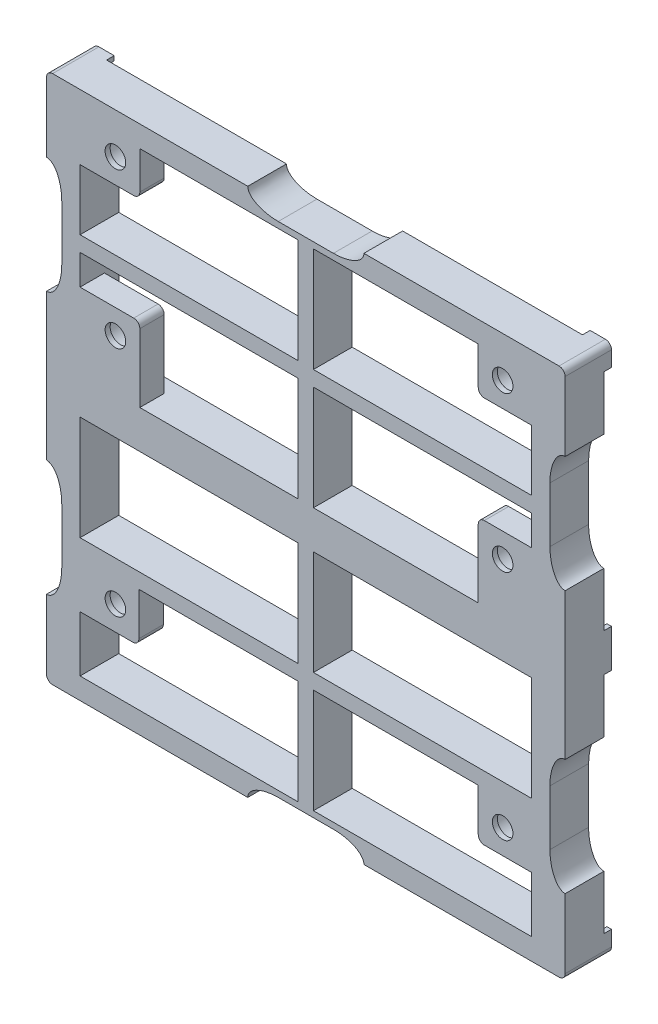
from build123d import *

# Parameters (mm, degrees)
SKETCH1_W                                        = 170.1
SKETCH1_H                                        = 87.55
SKETCH1_W_2                                      = 148.1
SKETCH1_H_2                                      = 73.55
SKETCH1_W_3                                      = 71.55
SKETCH1_H_3                                      = 5
SKETCH1_W_4                                      = 5
SKETCH1_H_4                                      = 34.275
BOSS_EXTRUDE1_DEPTH                              = 12.7
SKETCH2_W                                        = 2.5
SKETCH2_H                                        = 4.7
SKETCH2_W_2                                      = 4.501529918
SKETCH2_H_2                                      = 2.5
SKETCH2_W_3                                      = 4.5
BOSS_EXTRUDE2_DEPTH                              = 2.5
SKETCH12_W                                       = 167.1
SKETCH12_H                                       = 84.55
CUT_EXTRUDE2_DEPTH                               = 223.96352429
F_1_8_0_1250_DOWEL_HOLE2_AT_2_COUNT              = 2
F_1_8_0_1250_DOWEL_HOLE2_AT_2_PITCH              = 72.55
F_1_8_0_1250_DOWEL_HOLE2_AT_3_COUNT              = 2
F_1_8_0_1250_DOWEL_HOLE2_AT_3_PITCH              = 155.1
BOSS_EXTRUDE4_DEPTH                              = 8
CBORE_FOR_1_4_SOCKET_HEAD_CAP_SCREW1_D           = 6.7564
CBORE_FOR_1_4_SOCKET_HEAD_CAP_SCREW1_CBORE_D     = 11.1125
CBORE_FOR_1_4_SOCKET_HEAD_CAP_SCREW1_CBORE_DEPTH = 6.35
SKETCH13_W                                       = 10
SKETCH13_H                                       = 38.1
SKETCH13_W_2                                     = 38.1
SKETCH13_H_2                                     = 10
CUT_EXTRUDE3_DEPTH                               = 15
FILLET4_SIZE                                     = 10
FILLET4_SIZE_2                                   = 5
MIRROR1_OUTLINE_W                                = 71.55
MIRROR1_OUTLINE_H                                = 34.275
MIRROR1_DEPTH                                    = 12.7
MIRROR1_START                                    = -2.5
MIRROR1_2_OUTLINE_W                              = 1.5
MIRROR1_2_OUTLINE_H                              = 5.5
MIRROR1_2_DEPTH                                  = 2.5
FILLET2_R                                        = 2
BOSS_EXTRUDE5_DEPTH                              = 8
CBORE_FOR_1_4_SOCKET_HEAD_CAP_SCREW2_D           = 6.7564
CBORE_FOR_1_4_SOCKET_HEAD_CAP_SCREW2_CBORE_D     = 11.1125
CBORE_FOR_1_4_SOCKET_HEAD_CAP_SCREW2_CBORE_DEPTH = 6.35
LPATTERN3_COUNT                                  = 2
LPATTERN3_PITCH                                  = 86.05


# Read off the part's stored shape, not the designer's step: Mirror1
with BuildPart() as part:
    # Sketch1 → Boss-Extrude1 (new body)
    # profile 1 of 6: a face of its own
    with BuildSketch(Plane.XY):
        with Locations((-57.284342841, -127.375162174)):
            Rectangle(SKETCH1_W, SKETCH1_H)
        with Locations((-57.284342841, -127.375162174)):
            Rectangle(SKETCH1_W_2, SKETCH1_H_2, mode=Mode.SUBTRACT)
    # profile 2 of 6: a face of its own
    with BuildSketch(Plane.XY):
        with Locations((-95.559342841, -127.375162174)):
            Rectangle(SKETCH1_W_3, SKETCH1_H_3)
    # profile 3 of 6: a face of its own
    with BuildSketch(Plane.XY):
        with Locations((-57.284342841, -107.737662174)):
            Rectangle(SKETCH1_W_4, SKETCH1_H_4)
    # profile 4 of 6: a face of its own
    with BuildSketch(Plane.XY):
        with Locations((-19.009342841, -127.375162174)):
            Rectangle(SKETCH1_W_3, SKETCH1_H_3)
    # profile 5 of 6: a face of its own
    with BuildSketch(Plane.XY):
        with Locations((-57.284342841, -147.012662174)):
            Rectangle(SKETCH1_W_4, SKETCH1_H_4)
    # profile 6 of 6: a face of its own
    with BuildSketch(Plane.XY):
        with Locations((-57.284342841, -127.375162174)):
            Rectangle(SKETCH1_W_4, SKETCH1_H_3)
    extrude(amount=BOSS_EXTRUDE1_DEPTH)

    # Sketch2 → Boss-Extrude2 (add)
    with BuildSketch(Plane(origin=(0, 0, 0), x_dir=(-1, 0, 0), z_dir=(0, 0, -1))):
        Polygon((135.334342841, -168.850162174), (135.334342841, -171.150162174), (142.334342841, -171.150162174), (142.334342841, -168.850162174), (139.834342841, -168.850162174), align=None)
        with Locations((141.084342841, -166.500162174)):
            Rectangle(SKETCH2_W, SKETCH2_H)
        Polygon((139.834342841, -90.600162174), (142.334342841, -90.600162174), (142.334342841, -83.600162174), (139.834342841, -83.600162174), (139.834342841, -86.100162174), align=None)
        with Locations((137.583577882, -84.850162174)):
            Rectangle(SKETCH2_W_2, SKETCH2_H_2)
        Polygon((-27.765657159, -83.600162174), (-27.765657159, -90.600162174), (-25.265657159, -90.600162174), (-25.265657159, -86.100162174), (-25.265657159, -83.600162174), align=None)
        with Locations((-23.015657159, -84.850162174)):
            Rectangle(SKETCH2_W_3, SKETCH2_H_2)
        Polygon((-27.765657159, -164.150162174), (-27.765657159, -171.150162174), (-25.265657159, -171.150162174), (-25.265657159, -168.650162174), (-25.265657159, -164.150162174), align=None)
        with Locations((-23.015657159, -169.900162174)):
            Rectangle(SKETCH2_W_3, SKETCH2_H_2)
    extrude(amount=BOSS_EXTRUDE2_DEPTH)

    # Sketch12 → Cut-Extrude2 (cut, through all)
    with BuildSketch(Plane(origin=(0, 0, 0), x_dir=(-1, 0, 0), z_dir=(0, 0, -1))):
        with Locations((57.284342841, -127.375162174)):
            Rectangle(SKETCH12_W, SKETCH12_H)
    extrude(amount=CUT_EXTRUDE2_DEPTH, mode=Mode.SUBTRACT)

    # Sketch22 → 1/8 (0.1250) Dowel Hole2 (revolve, cut)
    with BuildSketch(Plane(origin=(20.265657159, -163.650162174, 0), x_dir=(0, 1, 0), z_dir=(1, 0, 0))):
        Polygon((0, 0), (0, 4.128866233), (1.5875, 3.175), (1.5875, 0), align=None)
    f_1_8_0_1250_dowel_hole2 = revolve(axis=Axis((20.265657159, -163.650162174, -6.35), (0, 0, 1)), mode=Mode.SUBTRACT)

    # 1/8 (0.1250) Dowel Hole2 at 2: 1/8 (0.1250) Dowel Hole2 ×2
    with Locations(*[(0, i * F_1_8_0_1250_DOWEL_HOLE2_AT_2_PITCH, 0) for i in range(1, F_1_8_0_1250_DOWEL_HOLE2_AT_2_COUNT)]):
        add(f_1_8_0_1250_dowel_hole2, mode=Mode.SUBTRACT)

    # 1/8 (0.1250) Dowel Hole2 at 3: 1/8 (0.1250) Dowel Hole2 ×2
    with Locations(*[(-i * F_1_8_0_1250_DOWEL_HOLE2_AT_3_PITCH, 0, 0) for i in range(1, F_1_8_0_1250_DOWEL_HOLE2_AT_3_COUNT)]):
        add(f_1_8_0_1250_dowel_hole2, mode=Mode.SUBTRACT)

    # Sketch4 → Boss-Extrude4 (add)
    with BuildSketch(Plane.XY.offset(12.7)):
        with BuildLine():
            Line((16.765657159, -90.600162174), (-0.734342841, -90.600162174))
            Line((-0.734342841, -90.600162174), (-0.734342841, -102.950162174))
            ThreePointArc((-0.734342841, -102.950162174), (-0.148556403, -104.364375736), (1.265657159, -104.950162174))
            Line((1.265657159, -104.950162174), (16.765657159, -104.950162174))
            Line((16.765657159, -104.950162174), (16.765657159, -90.600162174))
        make_face()
        with BuildLine():
            Line((-131.334342841, -164.150162174), (-111.734342841, -164.150162174))
            Line((-111.734342841, -164.150162174), (-111.734342841, -141.750162174))
            ThreePointArc((-111.734342841, -141.750162174), (-112.320129278, -140.335948611), (-113.734342841, -139.750162174))
            Line((-113.734342841, -139.750162174), (-131.334342841, -139.750162174))
            Line((-131.334342841, -139.750162174), (-131.334342841, -164.150162174))
        make_face()
        with BuildLine():
            Line((-131.334342841, -90.600162174), (-111.734342841, -90.600162174))
            Line((-111.734342841, -90.600162174), (-111.734342841, -102.950162174))
            ThreePointArc((-111.734342841, -102.950162174), (-112.320129278, -104.364375736), (-113.734342841, -104.950162174))
            Line((-113.734342841, -104.950162174), (-131.334342841, -104.950162174))
            Line((-131.334342841, -104.950162174), (-131.334342841, -90.600162174))
        make_face()
        with BuildLine():
            Line((16.765657159, -139.750162174), (1.265657159, -139.750162174))
            ThreePointArc((1.265657159, -139.750162174), (-0.148556403, -140.335948611), (-0.734342841, -141.750162174))
            Line((-0.734342841, -141.750162174), (-0.734342841, -164.150162174))
            Line((-0.734342841, -164.150162174), (16.765657159, -164.150162174))
            Line((16.765657159, -164.150162174), (16.765657159, -139.750162174))
        make_face()
    extrude(amount=-BOSS_EXTRUDE4_DEPTH)

    # CBORE for 1/4 Socket Head Cap Screw1 (through all)
    with Locations(Plane(origin=(0, 0, 4.7), x_dir=(-1, 0, 0), z_dir=(0, 0, -1))):
        with Locations((-7.265657159, -147.750162174), (-7.265657159, -96.950162174), (119.734342841, -96.950162174), (119.734342841, -147.750162174)):
            CounterBoreHole(CBORE_FOR_1_4_SOCKET_HEAD_CAP_SCREW1_D / 2, CBORE_FOR_1_4_SOCKET_HEAD_CAP_SCREW1_CBORE_D / 2, CBORE_FOR_1_4_SOCKET_HEAD_CAP_SCREW1_CBORE_DEPTH)

    # Sketch13 → Cut-Extrude3 (cut)
    with BuildSketch(Plane(origin=(0, 0, 0), x_dir=(-1, 0, 0), z_dir=(0, 0, -1))):
        with Locations((142.334342841, -127.375162174)):
            Rectangle(SKETCH13_W, SKETCH13_H)
        with Locations((57.283577882, -83.600162174)):
            Rectangle(SKETCH13_W_2, SKETCH13_H_2)
        with Locations((-27.765657159, -127.375162174)):
            Rectangle(SKETCH13_W, SKETCH13_H)
    extrude(amount=-CUT_EXTRUDE3_DEPTH, mode=Mode.SUBTRACT)

    # Fillet4
    # an asymmetric fillet: 10, 5 mm, written as the material it adds along each edge
    with BuildSketch(Plane(origin=(22.765657159, -146.425162174, 0), x_dir=(0, 1, 0), z_dir=(0, 0, 1)), Plane(origin=(-137.334342841, -108.325162174, 0), x_dir=(0, -1, 0), z_dir=(0, 0, 1))) as fillet4_piece_1:
        with BuildLine():
            Bezier((FILLET4_SIZE, 0), (0, 0), (0, -FILLET4_SIZE_2), weights=[1, 0.707106781, 1])
            Line((0, -FILLET4_SIZE_2), (0, 0))
            Line((0, 0), (FILLET4_SIZE, 0))
        make_face()
    extrude(amount=12.7)
    with BuildSketch(Plane(origin=(22.765657159, -108.325162174, 0), x_dir=(1, 0, 0), z_dir=(0, 0, 1)), Plane(origin=(-76.333577882, -88.600162174, 0), x_dir=(0, 1, 0), z_dir=(0, 0, 1)), Plane(origin=(-137.334342841, -146.425162174, 0), x_dir=(-1, 0, 0), z_dir=(0, 0, 1))) as fillet4_piece_2:
        with BuildLine():
            Bezier((FILLET4_SIZE_2, 0), (0, 0), (0, -FILLET4_SIZE), weights=[1, 0.707106781, 1])
            Line((0, -FILLET4_SIZE), (0, 0))
            Line((0, 0), (FILLET4_SIZE_2, 0))
        make_face()
    extrude(amount=12.7)
    with BuildSketch(Plane(origin=(-38.233577882, -88.600162174, 0), x_dir=(0, 1, 0), z_dir=(0, 0, 1))) as fillet4_piece_3:
        with BuildLine():
            Bezier((FILLET4_SIZE_2, 0), (0, 0), (0, FILLET4_SIZE), weights=[1, 0.707106781, 1])
            Line((0, FILLET4_SIZE), (0, 0))
            Line((0, 0), (FILLET4_SIZE_2, 0))
        make_face()
    extrude(amount=12.7)

    # Mirror1 outline → Mirror1 (add)
    with BuildSketch(Plane.XY):
        with BuildLine():
            Line((22.765657159, -222.475162174), (22.765657159, -204.375162174))
            add(Edge.make_bspline(
                [(22.765657159, -204.375162174), (22.765657159, -194.375162174), (27.765657159, -194.375162174)],
                knots=[0, 0, 0, 1, 1, 1], degree=2, weights=[1, 0.707106781, 1]))
            Line((27.765657159, -194.375162174), (27.765657159, -171.150162174))
            Line((27.765657159, -171.150162174), (-142.334342841, -171.150162174))
            Line((-142.334342841, -171.150162174), (-142.334342841, -194.375162174))
            add(Edge.make_bspline(
                [(-142.334342841, -194.375162174), (-137.334342841, -194.375162174), (-137.334342841, -204.375162174)],
                knots=[0, 0, 0, 1, 1, 1], degree=2, weights=[1, 0.707106781, 1]))
            Line((-137.334342841, -204.375162174), (-137.334342841, -222.475162174))
            add(Edge.make_bspline(
                [(-137.334342841, -222.475162174), (-137.334342841, -232.475162174), (-142.334342841, -232.475162174)],
                knots=[0, 0, 0, 1, 1, 1], degree=2, weights=[1, 0.707106781, 1]))
            Line((-142.334342841, -232.475162174), (-142.334342841, -257.200162174))
            Line((-142.334342841, -257.200162174), (-76.333577882, -257.200162174))
            add(Edge.make_bspline(
                [(-76.333577882, -257.200162174), (-76.333577882, -252.200162174), (-66.333577882, -252.200162174)],
                knots=[0, 0, 0, 1, 1, 1], degree=2, weights=[1, 0.707106781, 1]))
            Line((-66.333577882, -252.200162174), (-48.233577882, -252.200162174))
            add(Edge.make_bspline(
                [(-48.233577882, -252.200162174), (-38.233577882, -252.200162174), (-38.233577882, -257.200162174)],
                knots=[0, 0, 0, 1, 1, 1], degree=2, weights=[1, 0.707106781, 1]))
            Line((-38.233577882, -257.200162174), (27.765657159, -257.200162174))
            Line((27.765657159, -257.200162174), (27.765657159, -232.475162174))
            add(Edge.make_bspline(
                [(27.765657159, -232.475162174), (22.765657159, -232.475162174), (22.765657159, -222.475162174)],
                knots=[0, 0, 0, 1, 1, 1], degree=2, weights=[1, 0.707106781, 1]))
        make_face()
        with Locations((-95.559342841, -233.062662174)):
            Rectangle(MIRROR1_OUTLINE_W, MIRROR1_OUTLINE_H, mode=Mode.SUBTRACT)
        with Locations((-19.009342841, -233.062662174)):
            Rectangle(MIRROR1_OUTLINE_W, MIRROR1_OUTLINE_H, mode=Mode.SUBTRACT)
        with Locations((-95.559342841, -193.787662174)):
            Rectangle(MIRROR1_OUTLINE_W, MIRROR1_OUTLINE_H, mode=Mode.SUBTRACT)
        with Locations((-19.009342841, -193.787662174)):
            Rectangle(MIRROR1_OUTLINE_W, MIRROR1_OUTLINE_H, mode=Mode.SUBTRACT)
    extrude(amount=MIRROR1_DEPTH)

    # Mirror1 2 outline → Mirror1 2 (add)
    with BuildSketch(Plane.XY.offset(MIRROR1_START)):
        with Locations((27.015657159, -173.900162174)):
            Rectangle(MIRROR1_2_OUTLINE_W, MIRROR1_2_OUTLINE_H)
        Polygon((27.765657159, -257.200162174), (27.765657159, -250.200162174), (26.265657159, -250.200162174), (26.265657159, -255.700162174), (20.765657159, -255.700162174), (20.765657159, -257.200162174), align=None)
        with Locations((-141.584342841, -173.900162174)):
            Rectangle(MIRROR1_2_OUTLINE_W, MIRROR1_2_OUTLINE_H)
        Polygon((-142.334342841, -257.200162174), (-135.332812923, -257.200162174), (-135.332812923, -255.700162174), (-140.834342841, -255.700162174), (-140.834342841, -250.200162174), (-142.334342841, -250.200162174), align=None)
    extrude(amount=MIRROR1_2_DEPTH)

    # Fillet2
    fillet2_edges = [part.edges().sort_by_distance(p)[0] for p in [
        (27.765657159, -83.600162174, 5.1),
        (-142.334342841, -83.600162174, 5.1),
        (-142.334342841, -257.200162174, 5.1),
        (27.765657159, -257.200162174, 5.1),
    ]]
    fillet(fillet2_edges, radius=FILLET2_R)

    # Sketch14 → Boss-Extrude5 (add)
    with BuildSketch(Plane.XY.offset(12.7)):
        with BuildLine():
            Line((16.765657159, -215.925162174), (-0.734342841, -215.925162174))
            Line((-0.734342841, -215.925162174), (-0.734342841, -229.950162174))
            ThreePointArc((-0.734342841, -229.950162174), (-0.148556403, -231.364375736), (1.265657159, -231.950162174))
            Line((1.265657159, -231.950162174), (16.765657159, -231.950162174))
            Line((16.765657159, -231.950162174), (16.765657159, -215.925162174))
        make_face()
        with BuildLine():
            Line((-131.334342841, -215.925162174), (-112.034342841, -215.925162174))
            Line((-112.034342841, -215.925162174), (-112.034342841, -229.950162174))
            ThreePointArc((-112.034342841, -229.950162174), (-112.620129278, -231.364375736), (-114.034342841, -231.950162174))
            Line((-114.034342841, -231.950162174), (-131.334342841, -231.950162174))
            Line((-131.334342841, -231.950162174), (-131.334342841, -215.925162174))
        make_face()
    extrude(amount=-BOSS_EXTRUDE5_DEPTH)

    # CBORE for 1/4 Socket Head Cap Screw2 (through all)
    with Locations(Plane(origin=(0, 0, 4.7), x_dir=(-1, 0, 0), z_dir=(0, 0, -1))):
        with Locations((-7.265657159, -223.950162174), (119.734342634, -223.957414667)):
            CounterBoreHole(CBORE_FOR_1_4_SOCKET_HEAD_CAP_SCREW2_D / 2, CBORE_FOR_1_4_SOCKET_HEAD_CAP_SCREW2_CBORE_D / 2, CBORE_FOR_1_4_SOCKET_HEAD_CAP_SCREW2_CBORE_DEPTH)

    # LPattern3: 1/8 (0.1250) Dowel Hole2 ×2
    with Locations(*[(0, -i * LPATTERN3_PITCH, 0) for i in range(1, LPATTERN3_COUNT)]):
        add(f_1_8_0_1250_dowel_hole2, mode=Mode.SUBTRACT)

    # LPattern3 copy 1 sketch → LPattern3 copy 1 (revolve, cut)
    with BuildSketch(Plane(origin=(20.265657159, -177.150162174, 0), x_dir=(0, 1, 0), z_dir=(1, 0, 0))):
        Polygon((0, 0), (0, 4.128866233), (1.5875, 3.175), (1.5875, 0), align=None)
    revolve(axis=Axis((20.265657159, -177.150162174, -6.35), (0, 0, 1)), mode=Mode.SUBTRACT)

    # LPattern3 copy 2 sketch → LPattern3 copy 2 (revolve, cut)
    with BuildSketch(Plane(origin=(-134.834342841, -249.700162174, 0), x_dir=(0, 1, 0), z_dir=(1, 0, 0))):
        Polygon((0, 0), (0, 4.128866233), (1.5875, 3.175), (1.5875, 0), align=None)
    revolve(axis=Axis((-134.834342841, -249.700162174, -6.35), (0, 0, 1)), mode=Mode.SUBTRACT)


solid = part.part
